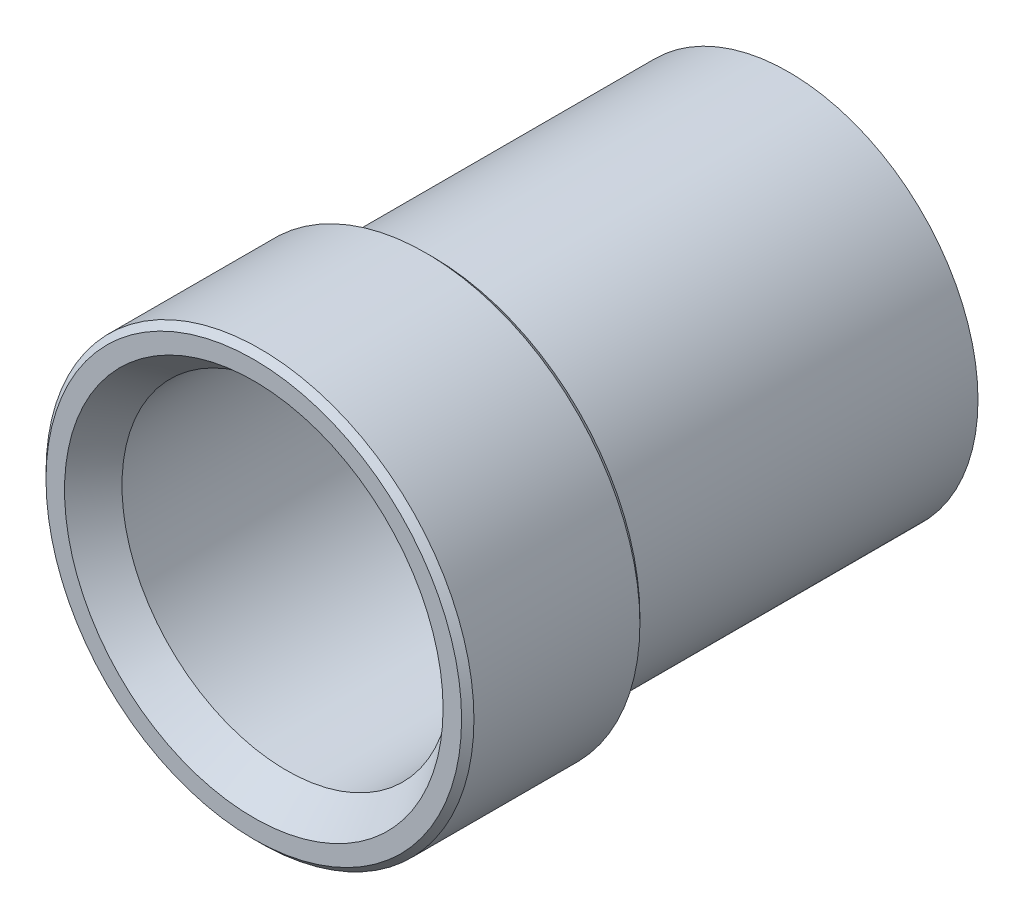
from build123d import *

# Parameters (mm, degrees)
CHAMFER1_SIZE = 0.1190625


with BuildPart() as part:
    # Sketch2 → Revolve1 (revolve)
    with BuildSketch(Plane(origin=(0, 0, 0), x_dir=(0, 0, -1), z_dir=(1, 0, 0))):
        Polygon((-4.527369904, 3.175), (-5.159375, 3.65125), (-5.159375, 4.1275), (-1.719791667, 4.1275), (-1.719791667, 3.65125), (5.159375, 3.65125), (5.159375, 3.175), align=None)
    revolve(axis=Axis((0, 0, 5.159375), (0, 0, -1)))

    # Chamfer1
    chamfer1_edges = [part.edges().sort_by_distance(p)[0] for p in [
        (0, -4.1275, 5.159375),
        (0, -4.1275, 1.719791667),
    ]]
    chamfer(chamfer1_edges, length=CHAMFER1_SIZE)


solid = part.part
